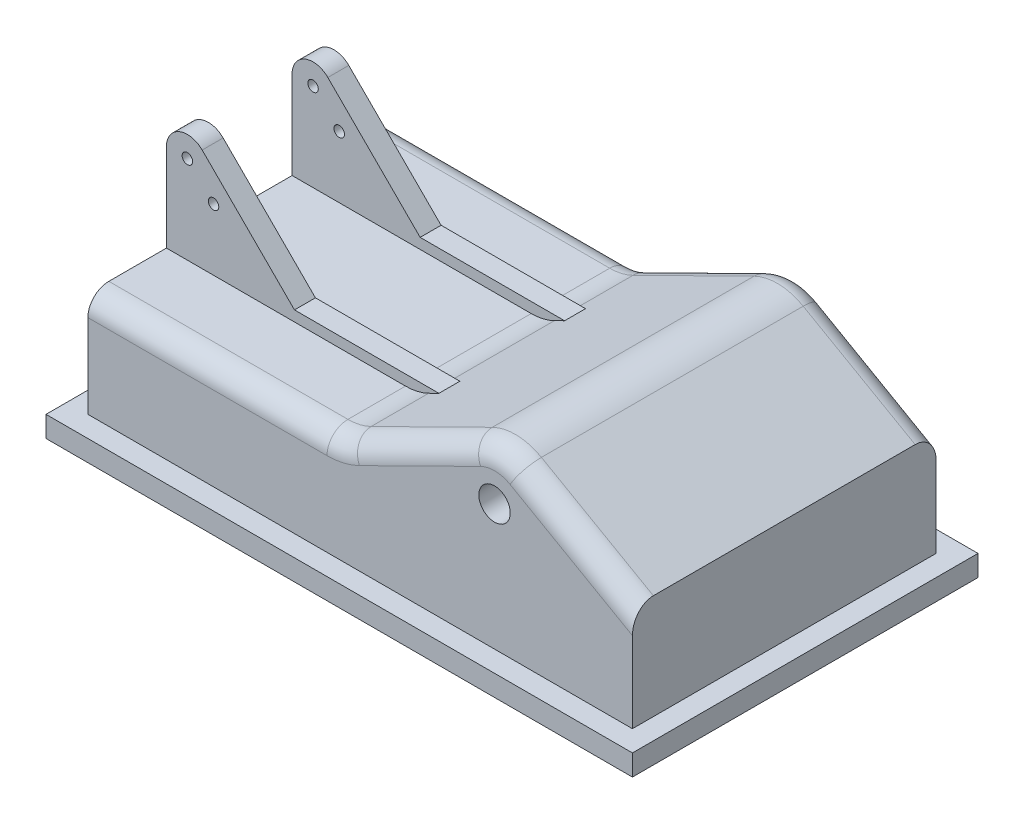
from build123d import *

# Parameters (mm, degrees)
SKETCH1_R           = 22.5
BOSS_EXTRUDE1_DEPTH = 217.5
BOSS_EXTRUDE2_START = -142.5
SKETCH2_R           = 7.5
BOSS_EXTRUDE2_DEPTH = 30
SHELL1_START        = -187.5
SHELL1_DEPTH        = 375
SKETCH3_W           = 840
SKETCH3_H           = 495
SKETCH3_W_2         = 720
SKETCH3_H_2         = 375
BOSS_EXTRUDE3_DEPTH = 30
FILLET1_R           = 30


# Read off the part's stored shape, not the designer's step: Shell1
with BuildPart() as part:
    # Sketch1 → Boss-Extrude1 (new, symmetric)
    with BuildSketch(Plane.XY):
        with BuildLine():
            Line((390, 0), (-390, 0))
            Line((-390, 0), (-390, 180))
            Line((-390, 180), (-47.523825825, 180))
            ThreePointArc((-47.523825825, 180), (-30.459602431, 181.967046616), (-14.290475646, 187.765005868))
            Line((-14.290475646, 187.765005868), (159.250519483, 273.543977608))
            ThreePointArc((159.250519483, 273.543977608), (194.705480887, 281.276072546), (229.640352409, 271.45801102))
            Line((229.640352409, 271.45801102), (390, 180))
            Line((390, 180), (390, 0))
        make_face()
        with Locations(Location((192.483869662, 210, 0), (0, 0, 180))):
            Circle(SKETCH1_R, mode=Mode.SUBTRACT)
    extrude(amount=BOSS_EXTRUDE1_DEPTH, both=True)


with BuildPart() as body_2:
    # Sketch2 → Boss-Extrude2 (new body)
    with BuildSketch(Plane.XY.offset(217.5).offset(BOSS_EXTRUDE2_START)):
        with BuildLine():
            Line((-390, 180), (-390, 306))
            ThreePointArc((-390, 306), (-371.480502971, 333.716385975), (-338.786796564, 327.213203436))
            Line((-338.786796564, 327.213203436), (-206.573593129, 195))
            Line((-206.573593129, 195), (0.34677234, 195))
            Line((0.34677234, 195), (-14.290475646, 187.765005868))
            ThreePointArc((-14.290475646, 187.765005868), (-30.459602431, 181.967046616), (-47.523825825, 180))
            Line((-47.523825825, 180), (-390, 180))
        make_face()
        with Locations((-360, 306)):
            Circle(SKETCH2_R, mode=Mode.SUBTRACT)
        with Locations((-322.5, 268.5)):
            Circle(SKETCH2_R, mode=Mode.SUBTRACT)
    boss_extrude2 = extrude(amount=BOSS_EXTRUDE2_DEPTH)


with BuildPart() as part_1:
    add(part.part)

    # Mirror7: Boss-Extrude2 across plane
    add(boss_extrude2.mirror(Plane.XY))

    # Shell1 outline → Shell1 (cut)
    with BuildSketch(Plane.XY.offset(SHELL1_START)):
        with BuildLine():
            Line((145.405891256, 233.236048487), (-0.997135575, 160.871008216))
            ThreePointArc((-0.997135575, 160.871008216), (-23.633913073, 152.753865263), (-47.523825825, 150))
            Line((-47.523825825, 150), (-360, 150))
            Line((-360, 150), (-360, 0))
            Line((-360, 0), (360, 0))
            Line((360, 0), (360, 162.573715059))
            Line((360, 162.573715059), (240.789153251, 230.563306577))
            ThreePointArc((240.789153251, 230.563306577), (191.013340222, 157.520598868), (145.405891256, 233.236048487))
        make_face()
    extrude(amount=SHELL1_DEPTH, mode=Mode.SUBTRACT)

    # Sketch3 → Boss-Extrude3 (add)
    with BuildSketch(Plane.XZ):
        Rectangle(SKETCH3_W, SKETCH3_H)
        Rectangle(SKETCH3_W_2, SKETCH3_H_2, mode=Mode.SUBTRACT)
    extrude(amount=-BOSS_EXTRUDE3_DEPTH)

    # Fillet1
    fillet1_edges = [part_1.edges().sort_by_distance(p)[0] for p in [
        (-218.761912913, 180, -217.5),
        (-30.459602431, 181.967046616, -217.5),
        (309.820176204, 225.72900551, 217.5),
        (194.705480887, 281.276072546, 217.5),
        (72.480021918, 230.654491738, 217.5),
        (-30.459602431, 181.967046616, 217.5),
        (-218.761912913, 180, 217.5),
        (72.480021918, 230.654491738, -217.5),
        (194.705480887, 281.276072546, -217.5),
        (309.820176204, 225.72900551, -217.5),
    ]]
    fillet(fillet1_edges, radius=FILLET1_R)


solid = Compound([body_2.part, part_1.part])
